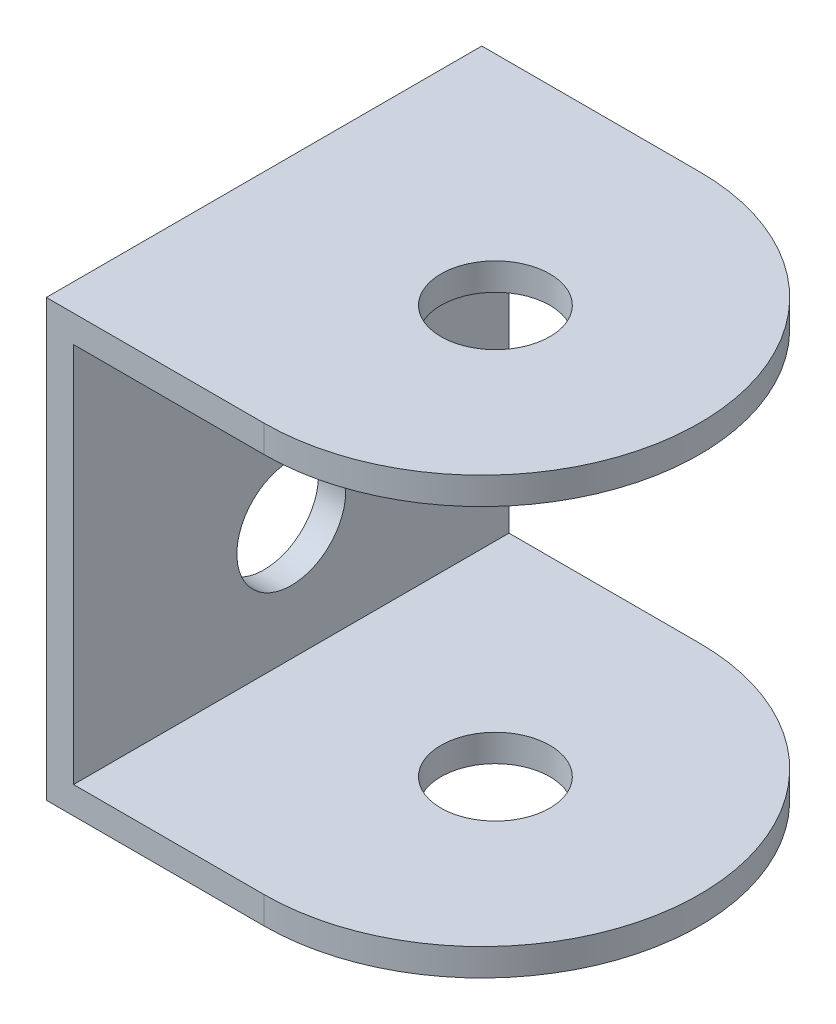
from build123d import *

# Parameters (mm, degrees)
EXTRUDE_THIN1_DEPTH = 25.4
SKETCH3_R           = 3.175
CUT_EXTRUDE1_DEPTH  = 44.097043475
FILLET1_R           = 12.7
SKETCH5_W           = 25.4
SKETCH5_H           = 1.5875
BOSS_EXTRUDE1_DEPTH = 25.4
SKETCH6_R           = 3.175
CUT_EXTRUDE3_DEPTH  = 25.4


with BuildPart() as part:
    # Sketch1 → Extrude-Thin1 (new body)
    with BuildSketch(Plane.XY):
        Polygon((0, 25.4), (0, 0), (25.4, 0), (25.4, 1.5875), (1.5875, 1.5875), (1.5875, 25.4), align=None)
    extrude(amount=EXTRUDE_THIN1_DEPTH)

    # Sketch3 → Cut-Extrude1 (cut, through all)
    with BuildSketch(Plane(origin=(1.5875, 0, 0), x_dir=(0, 0, -1), z_dir=(1, 0, 0))):
        with Locations((-12.7, 16.933333333)):
            Circle(SKETCH3_R)
        with Locations((-12.7, 8.466666667)):
            Circle(SKETCH3_R)
    extrude(amount=-CUT_EXTRUDE1_DEPTH, mode=Mode.SUBTRACT)

    # Fillet1
    fillet1_edges = [part.edges().sort_by_distance(p)[0] for p in [
        (25.4, 0.79375, 0),
        (25.4, 0.79375, 25.4),
    ]]
    fillet(fillet1_edges, radius=FILLET1_R - 0.0001)  # a hair under: the kernel refuses the full size

    # Sketch5 → Boss-Extrude1 (add)
    with BuildSketch(Plane.ZY):
        with Locations((12.7, 24.60625)):
            Rectangle(SKETCH5_W, SKETCH5_H)
    extrude(amount=-BOSS_EXTRUDE1_DEPTH)

    # Sketch6 → Cut-Extrude3 (cut)
    with BuildSketch(Plane(origin=(0, 25.4, 0), x_dir=(1, 0, 0), z_dir=(0, 1, 0))):
        with Locations(Location((13.49375, -12.7, 0), (0, 0, 270))):
            Circle(SKETCH6_R)
        with BuildLine():
            Line((25.4, -25.4), (25.4, -12.7))
            ThreePointArc((25.4, -12.7), (21.680256104, -21.680256138), (12.699999951, -25.4))
            Line((12.699999951, -25.4), (25.4, -25.4))
        make_face()
        with BuildLine():
            ThreePointArc((12.7, 0), (21.680256121, -3.719743879), (25.4, -12.7))
            Line((25.4, -12.7), (25.4, 0))
            Line((25.4, 0), (12.7, 0))
        make_face()
    extrude(amount=-CUT_EXTRUDE3_DEPTH, mode=Mode.SUBTRACT)


solid = part.part
